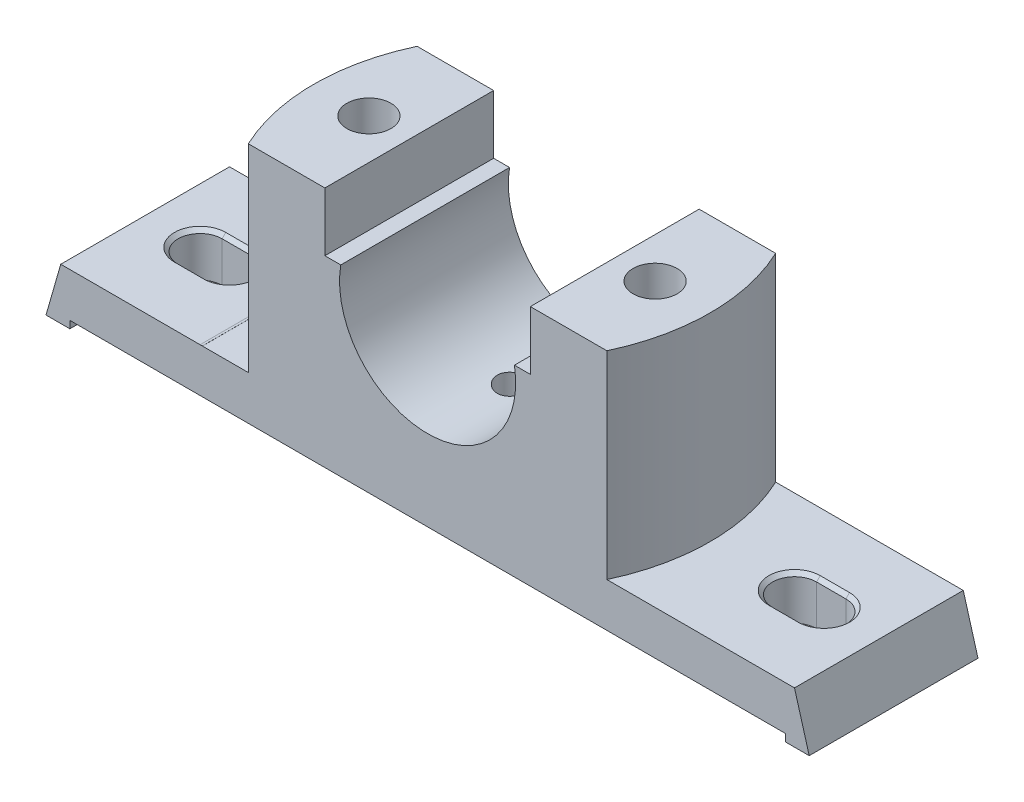
from build123d import *

# Parameters (mm, degrees)
BOSS_EXTRUDE2_DEPTH  = 46
CUT_EXTRUDE1_START   = -52.000000108
CUT_EXTRUDE1_DEPTH   = 36.000000108
CUT_EXTRUDE1_START_2 = 18
CUT_EXTRUDE1_2_DEPTH = 10
CUT_EXTRUDE4_DEPTH   = 126.888839891
CHAMFER1_SIZE        = 1
CUT_EXTRUDE6_DEPTH   = 54
SKETCH7_W            = 28
SKETCH7_H            = 28
CUT_EXTRUDE7_DEPTH   = 10
SKETCH8_R            = 6
CUT_EXTRUDE8_DEPTH   = 127.759615321


with BuildPart() as part:
    # Sketch1 → Boss-Extrude2 (new body)
    with BuildSketch(Plane.XY):
        with BuildLine():
            Line((-28, 20), (-28, 4))
            Line((-28, 4), (-23.664319132, 4))
            ThreePointArc((-23.664319132, 4), (0, -24), (23.664319132, 4))
            Line((23.664319132, 4), (28, 4))
            Line((28, 4), (28, 20))
            Line((28, 20), (54, 20))
            Line((54, 20), (54, -26))
            ThreePointArc((54, -26), (56.343145751, -31.656854249), (62, -34))
            Line((62, -34), (99.985564599, -34))
            Line((99.985564599, -34), (104, -48))
            Line((104, -48), (97.5, -48))
            Line((97.5, -48), (97.5, -46))
            Line((97.5, -46), (-97.5, -46))
            Line((-97.5, -46), (-97.5, -48))
            Line((-97.5, -48), (-104, -48))
            Line((-104, -48), (-99.985564599, -34))
            Line((-99.985564599, -34), (-62, -34))
            ThreePointArc((-62, -34), (-56.343145751, -31.656854249), (-54, -26))
            Line((-54, -26), (-54, 20))
            Line((-54, 20), (-28, 20))
        make_face()
    extrude(amount=BOSS_EXTRUDE2_DEPTH)

    # Cut-Extrude1: read off the stored shape, not the designer's step
    # Cut-Extrude1 outline → Cut-Extrude1 (cut)
    with BuildSketch(Plane(origin=(0, 20, 0), x_dir=(1, 0, 0), z_dir=(0, 1, 0)).offset(CUT_EXTRUDE1_START)):
        with BuildLine():
            add(Edge.make_bspline(
                [(-4, -23), (-4, -21.940981337), (-3.564754015, -20.907732875), (-2.091459192, -19.434771906), (-1.047779124, -19.000600686), (1.043187737, -18.999400631), (2.08248981, -19.42606245), (3.572744195, -20.91546352), (3.999590121, -21.953345573), (4.000409264, -24.043519212), (3.567812098, -25.087662609), (2.094321457, -26.563907402), (1.060428453, -26.999150693), (-1.054011474, -27.000846733), (-2.089559005, -26.5661873), (-3.563043078, -25.094915922), (-4, -24.059018663), (-4, -23)],
                knots=[0, 0, 0, 0, 0.125, 0.125, 0.25, 0.25, 0.375, 0.375, 0.5, 0.5, 0.625, 0.625, 0.75, 0.75, 0.875, 0.875, 1, 1, 1, 1], degree=3))
        make_face()
    extrude(amount=CUT_EXTRUDE1_DEPTH, mode=Mode.SUBTRACT)

    # Cut-Extrude1 2 outline → Cut-Extrude1 2 (add)
    with BuildSketch(Plane.XY.offset(CUT_EXTRUDE1_START_2)):
        with BuildLine():
            Line((5, -31.49528396), (4.000099427, -31.664302326))
            ThreePointArc((4.000099427, -31.664302326), (2.007080448, -31.915928334), (-8.2e-08, -32))
            Line((-8.2e-08, -32), (5, -32.000000108))
            Line((5, -32.000000108), (5, -31.49528396))
        make_face()
        with BuildLine():
            Line((-5, -32.000000108), (-8.2e-08, -32))
            ThreePointArc((-8.2e-08, -32), (-2.00703047, -31.915932528), (-4.000000362, -31.664319071))
            Line((-4.000000362, -31.664319071), (-5, -31.495288265))
            Line((-5, -31.495288265), (-5, -32.000000108))
        make_face()
    extrude(amount=CUT_EXTRUDE1_2_DEPTH)

    # Sketch5 → Cut-Extrude4 (cut, through all)
    with BuildSketch(Plane(origin=(0, -34, 0), x_dir=(1, 0, 0), z_dir=(0, 1, 0))):
        with BuildLine():
            Line((77, -17), (85, -17))
            ThreePointArc((85, -17), (91, -23), (85, -29))
            Line((85, -29), (77, -29))
            ThreePointArc((77, -29), (71, -23), (77, -17))
        make_face()
        with BuildLine():
            Line((-77, -17), (-85, -17))
            ThreePointArc((-85, -17), (-91, -23), (-85, -29))
            Line((-85, -29), (-77, -29))
            ThreePointArc((-77, -29), (-71, -23), (-77, -17))
        make_face()
    extrude(amount=-CUT_EXTRUDE4_DEPTH, mode=Mode.SUBTRACT)

    # Chamfer1
    chamfer1_edges = [part.edges().sort_by_distance(p)[0] for p in [
        (71, -34, 23),
        (81, -34, 29),
        (91, -34, 23),
        (81, -34, 17),
        (-71, -34, 23),
        (-81, -34, 17),
        (-91, -34, 23),
        (-81, -34, 29),
    ]]
    chamfer(chamfer1_edges, length=CHAMFER1_SIZE)

    # Sketch6 → Cut-Extrude6 (cut)
    with BuildSketch(Plane(origin=(0, 20, 0), x_dir=(1, 0, 0), z_dir=(0, 1, 0))):
        with BuildLine():
            Line((54, -46), (48.856934001, -46))
            ThreePointArc((48.856934001, -46), (54, -23), (48.856934001, 0))
            Line((48.856934001, 0), (54, 0))
            Line((54, 0), (63.209098635, 0))
            Line((63.209098635, 0), (63.209098635, -46))
            Line((63.209098635, -46), (54, -46))
        make_face()
        with BuildLine():
            Line((-48.856934001, -46), (-54, -46))
            Line((-54, -46), (-61.379097466, -46))
            Line((-61.379097466, -46), (-61.379097466, 0))
            Line((-61.379097466, 0), (-54, 0))
            Line((-54, 0), (-48.856934001, 0))
            ThreePointArc((-48.856934001, 0), (-54, -23), (-48.856934001, -46))
        make_face()
    extrude(amount=-CUT_EXTRUDE6_DEPTH, mode=Mode.SUBTRACT)

    # Sketch7 → Cut-Extrude7 (cut)
    with BuildSketch(Plane.XZ.offset(46)):
        with Locations((-39, 23)):
            Rectangle(SKETCH7_W, SKETCH7_H)
        with Locations((39, 23)):
            Rectangle(SKETCH7_W, SKETCH7_H)
    extrude(amount=-CUT_EXTRUDE7_DEPTH, mode=Mode.SUBTRACT)

    # Sketch8 → Cut-Extrude8 (cut, through all)
    with BuildSketch(Plane.XZ.offset(36)):
        with Locations((-39, 23)):
            Circle(SKETCH8_R)
        with Locations((39, 23)):
            Circle(SKETCH8_R)
    extrude(amount=-CUT_EXTRUDE8_DEPTH, mode=Mode.SUBTRACT)


solid = part.part
